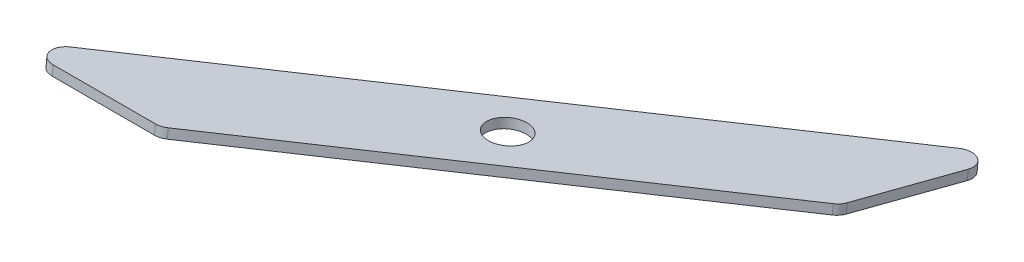
from build123d import *

# Parameters (mm, degrees)
SKETCH1_R           = 3.2639
BOSS_EXTRUDE1_DEPTH = 1.5875
FILLET1_R           = 2.54


with BuildPart() as part:
    # Sketch1 → Boss-Extrude1 (new body)
    with BuildSketch(Plane(origin=(0, -201.868081088, 19.866922985), x_dir=(-1, 0, 0), z_dir=(2.762928774657781e-13, -0.9951921043526863, 0.0979422045599961))):
        Polygon((-210.818868144, -585.101605173), (-147.350181938, -636.239910003), (-122.047729402, -636.239910003), (-216.201067918, -560.378214833), align=None)
        with Locations((-174.104461851, -604.489910003)):
            Circle(SKETCH1_R, mode=Mode.SUBTRACT)
    extrude(amount=BOSS_EXTRUDE1_DEPTH)

    # Fillet1
    fillet1_edges = [part.edges().sort_by_distance(p)[0] for p in [
        (122.047729402, -140.343275406, 653.125599519),
        (147.350181938, -140.343275406, 653.125599519),
        (210.818868144, -145.351873718, 602.233162322),
        (216.201067918, -147.773337073, 577.628639462),
    ]]
    fillet(fillet1_edges, radius=FILLET1_R)


solid = part.part
